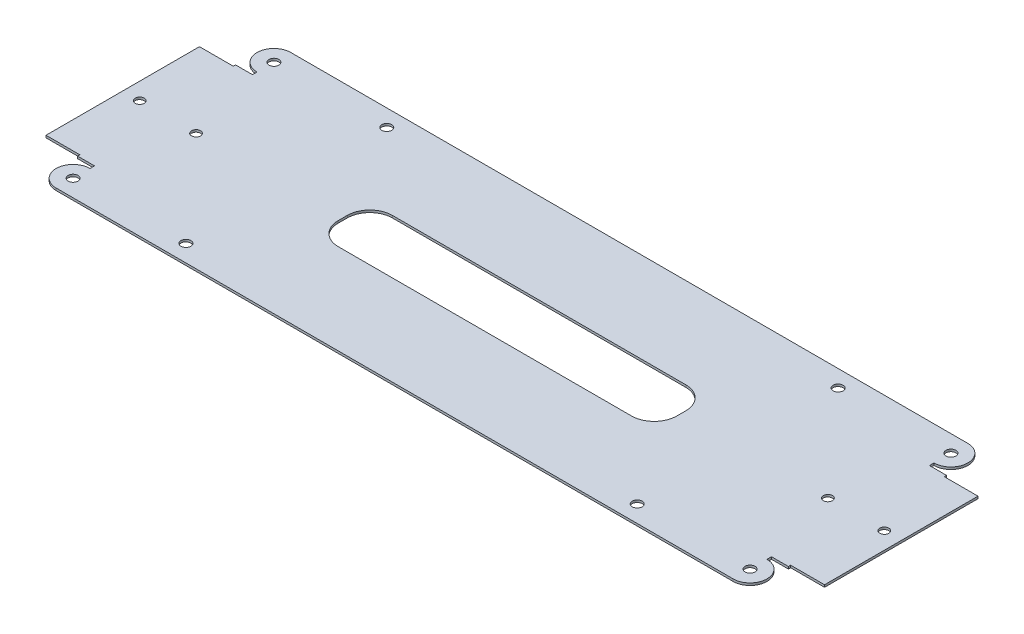
from build123d import *

# Parameters (mm, degrees)
SKETCH1_R           = 2.2
SKETCH1_R_2         = 2
SKETCH1_W           = 150
SKETCH1_H           = 24
BOSS_EXTRUDE1_DEPTH = 1
FILLET1_R           = 10


with BuildPart() as part:
    # Sketch1 → Boss-Extrude1 (new body)
    with BuildSketch(Plane(origin=(0, 0, 0), x_dir=(1, 0, 0), z_dir=(0, 1, 0))):
        with BuildLine():
            ThreePointArc((150, 37), (157.5, 44.5), (150, 52))
            Line((150, 52), (-150, 52))
            ThreePointArc((-150, 52), (-157.5, 44.5), (-150, 37))
            Line((-150, 37), (-150, 35))
            Line((-150, 35), (-157.5, 35))
            Line((-157.5, 35), (-157.5, 34))
            Line((-157.5, 34), (-172.5, 34))
            Line((-172.5, 34), (-172.5, -34))
            Line((-172.5, -34), (-157.5, -34))
            Line((-157.5, -34), (-157.5, -35))
            Line((-157.5, -35), (-150, -35))
            Line((-150, -35), (-150, -37))
            ThreePointArc((-150, -37), (-157.5, -44.5), (-150, -52))
            Line((-150, -52), (150, -52))
            ThreePointArc((150, -52), (157.5, -44.5), (150, -37))
            Line((150, -37), (150, -35))
            Line((150, -35), (157.5, -35))
            Line((157.5, -35), (157.5, -34))
            Line((157.5, -34), (172.5, -34))
            Line((172.5, -34), (172.5, 34))
            Line((172.5, 34), (157.5, 34))
            Line((157.5, 34), (157.5, 35))
            Line((157.5, 35), (150, 35))
            Line((150, 35), (150, 37))
        make_face()
        with Locations((-150, -44.5)):
            Circle(SKETCH1_R, mode=Mode.SUBTRACT)
        with Locations((-100, -44.5)):
            Circle(SKETCH1_R, mode=Mode.SUBTRACT)
        with Locations((-165, 0)):
            Circle(SKETCH1_R_2, mode=Mode.SUBTRACT)
        with Locations((-140, 0)):
            Circle(SKETCH1_R_2, mode=Mode.SUBTRACT)
        with Locations((100, -44.5)):
            Circle(SKETCH1_R, mode=Mode.SUBTRACT)
        with Locations((150, -44.5)):
            Circle(SKETCH1_R, mode=Mode.SUBTRACT)
        Rectangle(SKETCH1_W, SKETCH1_H, mode=Mode.SUBTRACT)
        with Locations((140, 0)):
            Circle(SKETCH1_R_2, mode=Mode.SUBTRACT)
        with Locations((165, 0)):
            Circle(SKETCH1_R_2, mode=Mode.SUBTRACT)
        with Locations((-150, 44.5)):
            Circle(SKETCH1_R, mode=Mode.SUBTRACT)
        with Locations((-100, 44.5)):
            Circle(SKETCH1_R, mode=Mode.SUBTRACT)
        with Locations((100, 44.5)):
            Circle(SKETCH1_R, mode=Mode.SUBTRACT)
        with Locations((150, 44.5)):
            Circle(SKETCH1_R, mode=Mode.SUBTRACT)
    extrude(amount=BOSS_EXTRUDE1_DEPTH)

    # Fillet1
    fillet1_edges = [part.edges().sort_by_distance(p)[0] for p in [
        (75, 0.5, 12),
        (75, 0.5, -12),
        (-75, 0.5, -12),
        (-75, 0.5, 12),
    ]]
    fillet(fillet1_edges, radius=FILLET1_R)


solid = part.part
